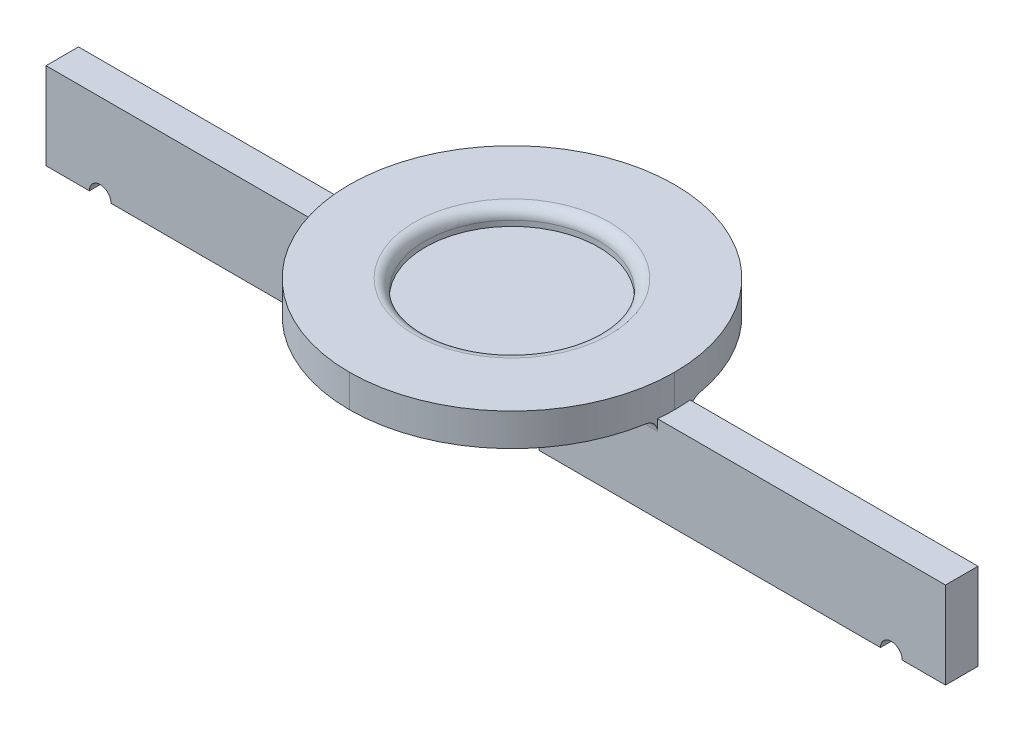
from build123d import *

# Parameters (mm, degrees)
SKETCH1_W                = 30
SKETCH1_H                = 30
BOSS_EXTRUDE1_DEPTH      = 3
BOSS_EXTRUDE2_DEPTH      = 1.5
BOSS_EXTRUDE2_DEPTH_BACK = 1.5
SKETCH2_W                = 83
SKETCH2_H                = 8
CUT_EXTRUDE1_DEPTH       = 46.370695388
SKETCH5_R                = 8
CUT_EXTRUDE2_DEPTH       = 1.5
FILLET1_R                = 1
SKETCH6_R                = 1
CUT_EXTRUDE3_DEPTH       = 10
CUT_EXTRUDE4_REACH       = 47.478
SKETCH9_W                = 8
SKETCH9_H                = 0.5
FILLET2_R                = 1
FILLET3_R                = 1
FILLET4_R                = 15


# Some blends are built 0.0001 mm under size
with BuildPart() as part:
    # Sketch1 → Boss-Extrude1 (new body)
    with BuildSketch(Plane(origin=(0, 0, 0), x_dir=(1, 0, 0), z_dir=(0, 1, 0))):
        Rectangle(SKETCH1_W, SKETCH1_H)
    extrude(amount=BOSS_EXTRUDE1_DEPTH)

    # Sketch2 → Boss-Extrude2 (add, two sides: drawn at the far end of the back side and taken through both)
    with BuildSketch(Plane.XY.offset(-BOSS_EXTRUDE2_DEPTH_BACK)):
        with Locations((0, -4)):
            Rectangle(SKETCH2_W, SKETCH2_H)
    extrude(amount=BOSS_EXTRUDE2_DEPTH + BOSS_EXTRUDE2_DEPTH_BACK)

    # Sketch4 → Cut-Extrude1 (cut, through all)
    with BuildSketch(Plane.XY.offset(1.5)):
        with BuildLine():
            ThreePointArc((-35.5, -8), (-36.5, -7), (-37.5, -8))
            Line((-37.5, -8), (-35.5, -8))
        make_face()
        with BuildLine():
            ThreePointArc((37.5, -8), (36.5, -7), (35.5, -8))
            Line((35.5, -8), (37.5, -8))
        make_face()
    extrude(amount=-CUT_EXTRUDE1_DEPTH, mode=Mode.SUBTRACT)

    # Sketch5 → Cut-Extrude2 (cut)
    with BuildSketch(Plane(origin=(0, 3, 0), x_dir=(1, 0, 0), z_dir=(0, 1, 0))):
        with Locations(Location((0, 0, 0), (0, 0, 270))):
            Circle(SKETCH5_R)
    extrude(amount=-CUT_EXTRUDE2_DEPTH, mode=Mode.SUBTRACT)

    # Fillet1
    fillet1_edges = [part.edges().sort_by_distance(p)[0] for p in [
        (0, 3, -8),
    ]]
    fillet(fillet1_edges, radius=FILLET1_R)

    # Sketch6 → Cut-Extrude3 (cut)
    with BuildSketch(Plane.XY.offset(1.5)):
        with Locations((0, -2)):
            Circle(SKETCH6_R)
    extrude(amount=-CUT_EXTRUDE3_DEPTH, mode=Mode.SUBTRACT)

    # Cut-Extrude4: up to this face of the body (flat: up to its plane)
    cut_extrude4_end = Plane(part.part.faces().sort_by_distance((0, 0, 8.25))[0])
    # Sketch9 → Cut-Extrude4 (cut, up to the picked face)
    with BuildSketch(Plane.XZ.offset(8), mode=Mode.PRIVATE) as cut_extrude4_sk1:
        with Locations((0, -1.25)):
            Rectangle(SKETCH9_W, SKETCH9_H)
    cut_extrude4_tool1 = split(extrude(cut_extrude4_sk1.sketch, amount=-CUT_EXTRUDE4_REACH, mode=Mode.PRIVATE), bisect_by=cut_extrude4_end, keep=Keep.BOTH, mode=Mode.PRIVATE)
    # Sketch9 → Cut-Extrude4 (cut, up to the picked face)
    with BuildSketch(Plane.XZ.offset(8), mode=Mode.PRIVATE) as cut_extrude4_sk2:
        with Locations((0, 1.25)):
            Rectangle(SKETCH9_W, SKETCH9_H)
    cut_extrude4_tool2 = split(extrude(cut_extrude4_sk2.sketch, amount=-CUT_EXTRUDE4_REACH, mode=Mode.PRIVATE), bisect_by=cut_extrude4_end, keep=Keep.BOTH, mode=Mode.PRIVATE)
    add(cut_extrude4_tool1.solids().sort_by(Axis((0, -8, -1.25), (0, 1, 0)))[0], mode=Mode.SUBTRACT)
    add(cut_extrude4_tool2.solids().sort_by(Axis((0, -8, 1.25), (0, 1, 0)))[0], mode=Mode.SUBTRACT)

    # Fillet2
    # the kernel refuses this fillet: 1 mm, written as the material it adds along each edge
    with BuildSketch(Plane(origin=(-4, -8, -1), x_dir=(0, 0, -1), z_dir=(0, 1, 0))) as fillet2_piece_1_section:
        with BuildLine():
            CenterArc((1, -0.866025404), FILLET2_R, 120, 60)
            Line((0, -0.866025404), (0, 0))
            Line((0, 0), (0.5, 0))
        make_face()
    fillet2_piece_1 = extrude(amount=10.165063509, mode=Mode.PRIVATE)
    fillet2_piece_1 = split(fillet2_piece_1, bisect_by=Plane(origin=(-3.634974596, 1.5, -1.132242545), z_dir=(0, -1, 0)), keep=Keep.TOP, mode=Mode.PRIVATE)
    add(fillet2_piece_1)
    with BuildSketch(Plane(origin=(4, -8, -1), x_dir=(0, 0, -1), z_dir=(0, 1, 0))) as fillet2_piece_2_section:
        with BuildLine():
            CenterArc((1, 0.866025404), FILLET2_R, 180, 60)
            Line((0, 0.866025404), (0, 0))
            Line((0, 0), (0.5, 0))
        make_face()
    fillet2_piece_2 = extrude(amount=10.165063509, mode=Mode.PRIVATE)
    fillet2_piece_2 = split(fillet2_piece_2, bisect_by=Plane(origin=(3.634974596, 1.5, -1.132242545), z_dir=(0, -1, 0)), keep=Keep.TOP, mode=Mode.PRIVATE)
    add(fillet2_piece_2)
    with BuildSketch(Plane(origin=(-4, -8, 1), x_dir=(0, 0, 1), z_dir=(0, 1, 0))) as fillet2_piece_3_section:
        with BuildLine():
            CenterArc((1, 0.866025404), FILLET2_R, 180, 60)
            Line((0, 0.866025404), (0, 0))
            Line((0, 0), (0.5, 0))
        make_face()
    fillet2_piece_3 = extrude(amount=10.165063509, mode=Mode.PRIVATE)
    fillet2_piece_3 = split(fillet2_piece_3, bisect_by=Plane(origin=(-3.634974596, 1.5, 1.132242545), z_dir=(0, -1, 0)), keep=Keep.TOP, mode=Mode.PRIVATE)
    add(fillet2_piece_3)
    with BuildSketch(Plane(origin=(4, -8, 1), x_dir=(0, 0, 1), z_dir=(0, 1, 0))) as fillet2_piece_4_section:
        with BuildLine():
            CenterArc((1, -0.866025404), FILLET2_R, 120, 60)
            Line((0, -0.866025404), (0, 0))
            Line((0, 0), (0.5, 0))
        make_face()
    fillet2_piece_4 = extrude(amount=10.165063509, mode=Mode.PRIVATE)
    fillet2_piece_4 = split(fillet2_piece_4, bisect_by=Plane(origin=(3.634974596, 1.5, 1.132242545), z_dir=(0, -1, 0)), keep=Keep.TOP, mode=Mode.PRIVATE)
    add(fillet2_piece_4)

    # Fillet3
    fillet3_edges = [part.edges().sort_by_distance(p)[0] for p in [
        (9.5, 0, -1.5),
        (9.5, 0, 1.5),
        (-9.5, 0, 1.5),
        (-9.5, 0, -1.5),
    ]]
    fillet(fillet3_edges, radius=FILLET3_R)

    # Fillet4
    fillet4_edges = [part.edges().sort_by_distance(p)[0] for p in [
        (-15, 1.5, -15),
        (15, 1.5, -15),
        (15, 1.5, 15),
        (-15, 1.5, 15),
    ]]
    fillet(fillet4_edges, radius=FILLET4_R - 0.0001)  # a hair under: the kernel refuses the full size


solid = part.part
